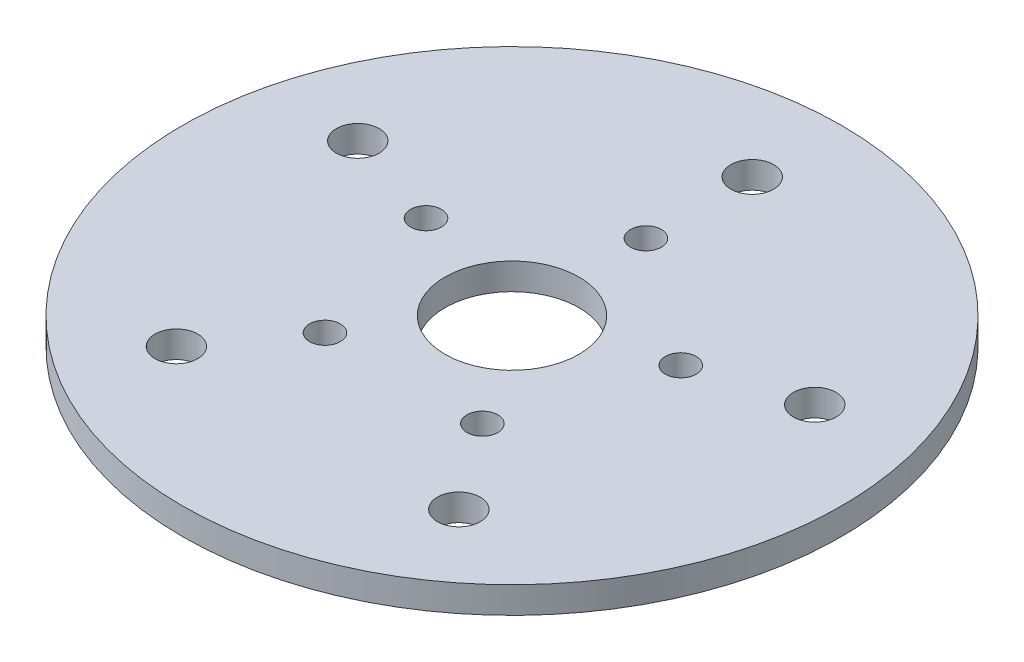
from build123d import *

# Parameters (mm, degrees)
SKETCH1_R           = 39.37
BOSS_EXTRUDE1_DEPTH = 3.175
SKETCH2_R           = 8.001
SKETCH2_R_2         = 1.8415
SKETCH2_R_3         = 2.5527
CUT_EXTRUDE1_DEPTH  = 56.768041251


with BuildPart() as part:
    # Sketch1 → Boss-Extrude1 (new body)
    with BuildSketch(Plane(origin=(0, 807.11642412, 0), x_dir=(-1, 0, 0), z_dir=(0, 1, 0))):
        Circle(SKETCH1_R)
    extrude(amount=-BOSS_EXTRUDE1_DEPTH)

    # Sketch2 → Cut-Extrude1 (cut, through all)
    with BuildSketch(Plane(origin=(0, 807.11642412, 0), x_dir=(1, 0, 0), z_dir=(0, 1, 0))):
        Circle(SKETCH2_R)
        with Locations((0, 16)):
            Circle(SKETCH2_R_2)
        with Locations((15.216904261, 4.94427191)):
            Circle(SKETCH2_R_2)
        with Locations((9.404564037, -12.94427191)):
            Circle(SKETCH2_R_2)
        with Locations((-9.404564037, -12.94427191)):
            Circle(SKETCH2_R_2)
        with Locations((-15.216904261, 4.94427191)):
            Circle(SKETCH2_R_2)
        with Locations((0, 28.702)):
            Circle(SKETCH2_R_3)
        with Locations((27.297224131, 8.869405773)):
            Circle(SKETCH2_R_3)
        with Locations((16.870612311, -23.220405773)):
            Circle(SKETCH2_R_3)
        with Locations((-16.870612311, -23.220405773)):
            Circle(SKETCH2_R_3)
        with Locations((-27.297224131, 8.869405773)):
            Circle(SKETCH2_R_3)
    extrude(amount=-CUT_EXTRUDE1_DEPTH, mode=Mode.SUBTRACT)


solid = part.part
